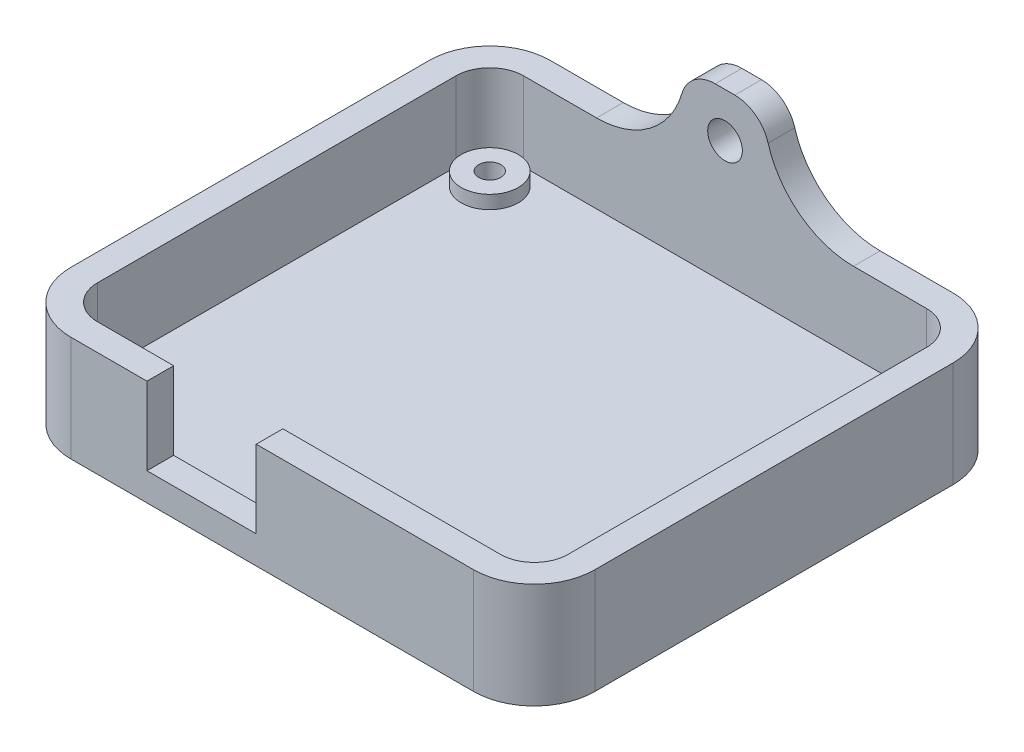
from build123d import *

# Parameters (mm, degrees)
BOSS_EXTRUDE1_DEPTH = 3
CUT_EXTRUDE1_REACH  = 77.661
SKETCH1_3_R         = 1.25
BOSS_EXTRUDE2_START = 8.86
BOSS_EXTRUDE2_DEPTH = 8.86
BOSS_EXTRUDE3_START = 1.5
SKETCH1_5_R         = 3.21
SKETCH1_5_R_2       = 1.25
BOSS_EXTRUDE3_DEPTH = 1.5
SKETCH2_W           = 12.28
SKETCH2_H           = 8.73
CUT_EXTRUDE2_DEPTH  = 3
SKETCH5_R           = 1.95
BOSS_EXTRUDE5_DEPTH = 3
FILLET1_R           = 10


with BuildPart() as part:
    # Sketch1 → Boss-Extrude1 (new body)
    with BuildSketch(Plane(origin=(0, 0, 0), x_dir=(1, 0, 0), z_dir=(0, 1, 0))):
        with BuildLine():
            Line((3.81, 3), (49.09, 3))
            ThreePointArc((49.09, 3), (53.90539718, 1.00539718), (55.9, -3.81))
            Line((55.9, -3.81), (55.9, -44.09))
            ThreePointArc((55.9, -44.09), (53.90539718, -48.90539718), (49.09, -50.9))
            Line((49.09, -50.9), (3.81, -50.9))
            ThreePointArc((3.81, -50.9), (-1.00539718, -48.90539718), (-3, -44.09))
            Line((-3, -44.09), (-3, -3.81))
            ThreePointArc((-3, -3.81), (-1.00539718, 1.00539718), (3.81, 3))
        make_face()
    extrude(amount=-BOSS_EXTRUDE1_DEPTH)

    # Sketch1<3> → Cut-Extrude1 (cut, up to next)
    with BuildSketch(Plane(origin=(0, 0, 0), x_dir=(1, 0, 0), z_dir=(0, 1, 0)), mode=Mode.PRIVATE) as cut_extrude1_sk1:
        with Locations((49.09, -44.09)):
            Circle(SKETCH1_3_R)
    cut_extrude1_tool1 = extrude(cut_extrude1_sk1.sketch, amount=-CUT_EXTRUDE1_REACH, mode=Mode.PRIVATE) & part.part
    # Sketch1<3> → Cut-Extrude1 (cut, up to next)
    with BuildSketch(Plane(origin=(0, 0, 0), x_dir=(1, 0, 0), z_dir=(0, 1, 0)), mode=Mode.PRIVATE) as cut_extrude1_sk2:
        with Locations((3.81, -44.09)):
            Circle(SKETCH1_3_R)
    cut_extrude1_tool2 = extrude(cut_extrude1_sk2.sketch, amount=-CUT_EXTRUDE1_REACH, mode=Mode.PRIVATE) & part.part
    # Sketch1<3> → Cut-Extrude1 (cut, up to next)
    with BuildSketch(Plane(origin=(0, 0, 0), x_dir=(1, 0, 0), z_dir=(0, 1, 0)), mode=Mode.PRIVATE) as cut_extrude1_sk3:
        with Locations((3.81, -3.81)):
            Circle(SKETCH1_3_R)
    cut_extrude1_tool3 = extrude(cut_extrude1_sk3.sketch, amount=-CUT_EXTRUDE1_REACH, mode=Mode.PRIVATE) & part.part
    # Sketch1<3> → Cut-Extrude1 (cut, up to next)
    with BuildSketch(Plane(origin=(0, 0, 0), x_dir=(1, 0, 0), z_dir=(0, 1, 0)), mode=Mode.PRIVATE) as cut_extrude1_sk4:
        with Locations((49.09, -3.81)):
            Circle(SKETCH1_3_R)
    cut_extrude1_tool4 = extrude(cut_extrude1_sk4.sketch, amount=-CUT_EXTRUDE1_REACH, mode=Mode.PRIVATE) & part.part
    add(cut_extrude1_tool1.solids().sort_by_distance((49.09, 0, 44.09))[0], mode=Mode.SUBTRACT)
    add(cut_extrude1_tool2.solids().sort_by_distance((3.81, 0, 44.09))[0], mode=Mode.SUBTRACT)
    add(cut_extrude1_tool3.solids().sort_by_distance((3.81, 0, 3.81))[0], mode=Mode.SUBTRACT)
    add(cut_extrude1_tool4.solids().sort_by_distance((49.09, 0, 3.81))[0], mode=Mode.SUBTRACT)

    # Sketch1<4> → Boss-Extrude2 (add)
    with BuildSketch(Plane(origin=(0, 0, 0), x_dir=(1, 0, 0), z_dir=(0, 1, 0)).offset(BOSS_EXTRUDE2_START)):
        with BuildLine():
            Line((49.09, 3), (3.81, 3))
            ThreePointArc((3.81, 3), (-1.00539718, 1.00539718), (-3, -3.81))
            Line((-3, -3.81), (-3, -44.09))
            ThreePointArc((-3, -44.09), (-1.00539718, -48.90539718), (3.81, -50.9))
            Line((3.81, -50.9), (49.09, -50.9))
            ThreePointArc((49.09, -50.9), (53.90539718, -48.90539718), (55.9, -44.09))
            Line((55.9, -44.09), (55.9, -3.81))
            ThreePointArc((55.9, -3.81), (53.90539718, 1.00539718), (49.09, 3))
        make_face()
        with BuildLine():
            ThreePointArc((0, -3.81), (1.115923164, -1.115923164), (3.81, 0))
            Line((3.81, 0), (49.09, 0))
            ThreePointArc((49.09, 0), (51.784076836, -1.115923164), (52.9, -3.81))
            Line((52.9, -3.81), (52.9, -44.09))
            ThreePointArc((52.9, -44.09), (51.784076836, -46.784076836), (49.09, -47.9))
            Line((49.09, -47.9), (3.81, -47.9))
            ThreePointArc((3.81, -47.9), (1.115923164, -46.784076836), (0, -44.09))
            Line((0, -44.09), (0, -3.81))
        make_face(mode=Mode.SUBTRACT)
    extrude(amount=-BOSS_EXTRUDE2_DEPTH)

    # Sketch1<5> → Boss-Extrude3 (add)
    # profile 1 of 4: a face of its own
    with BuildSketch(Plane(origin=(0, 0, 0), x_dir=(1, 0, 0), z_dir=(0, 1, 0)).offset(BOSS_EXTRUDE3_START)):
        with Locations((3.81, -3.81)):
            Circle(SKETCH1_5_R)
        with Locations((3.81, -3.81)):
            Circle(SKETCH1_5_R_2, mode=Mode.SUBTRACT)
    # profile 2 of 4: a face of its own
    with BuildSketch(Plane(origin=(0, 0, 0), x_dir=(1, 0, 0), z_dir=(0, 1, 0)).offset(BOSS_EXTRUDE3_START)):
        with Locations((49.09, -3.81)):
            Circle(SKETCH1_5_R)
        with Locations((49.09, -3.81)):
            Circle(SKETCH1_5_R_2, mode=Mode.SUBTRACT)
    # profile 3 of 4: a face of its own
    with BuildSketch(Plane(origin=(0, 0, 0), x_dir=(1, 0, 0), z_dir=(0, 1, 0)).offset(BOSS_EXTRUDE3_START)):
        with Locations((49.09, -44.09)):
            Circle(SKETCH1_5_R)
        with Locations((49.09, -44.09)):
            Circle(SKETCH1_5_R_2, mode=Mode.SUBTRACT)
    # profile 4 of 4: a face of its own
    with BuildSketch(Plane(origin=(0, 0, 0), x_dir=(1, 0, 0), z_dir=(0, 1, 0)).offset(BOSS_EXTRUDE3_START)):
        with Locations((3.81, -44.09)):
            Circle(SKETCH1_5_R)
        with Locations((3.81, -44.09)):
            Circle(SKETCH1_5_R_2, mode=Mode.SUBTRACT)
    extrude(amount=-BOSS_EXTRUDE3_DEPTH)

    # Sketch2 → Cut-Extrude2 (cut)
    with BuildSketch(Plane.XY.offset(50.9)):
        with Locations((18.5, 4.5)):
            Rectangle(SKETCH2_W, SKETCH2_H)
    extrude(amount=-CUT_EXTRUDE2_DEPTH, mode=Mode.SUBTRACT)

    # Sketch5 → Boss-Extrude5 (add)
    with BuildSketch(Plane(origin=(0, 0, -3), x_dir=(-1, 0, 0), z_dir=(0, 0, -1))):
        with BuildLine():
            Line((-31.45, 8.86), (-21.45, 8.86))
            Line((-21.45, 8.86), (-21.45, 14.96))
            ThreePointArc((-21.45, 14.96), (-22.592283553, 17.717716447), (-25.35, 18.86))
            Line((-25.35, 18.86), (-27.55, 18.86))
            ThreePointArc((-27.55, 18.86), (-30.307716447, 17.717716447), (-31.45, 14.96))
            Line((-31.45, 14.96), (-31.45, 8.86))
        make_face()
        with Locations((-26.45, 13.86)):
            Circle(SKETCH5_R, mode=Mode.SUBTRACT)
    extrude(amount=-BOSS_EXTRUDE5_DEPTH)

    # Fillet1
    fillet1_edges = [part.edges().sort_by_distance(p)[0] for p in [
        (21.45, 8.86, -1.5),
        (31.45, 8.86, -1.5),
    ]]
    fillet(fillet1_edges, radius=FILLET1_R)


solid = part.part
